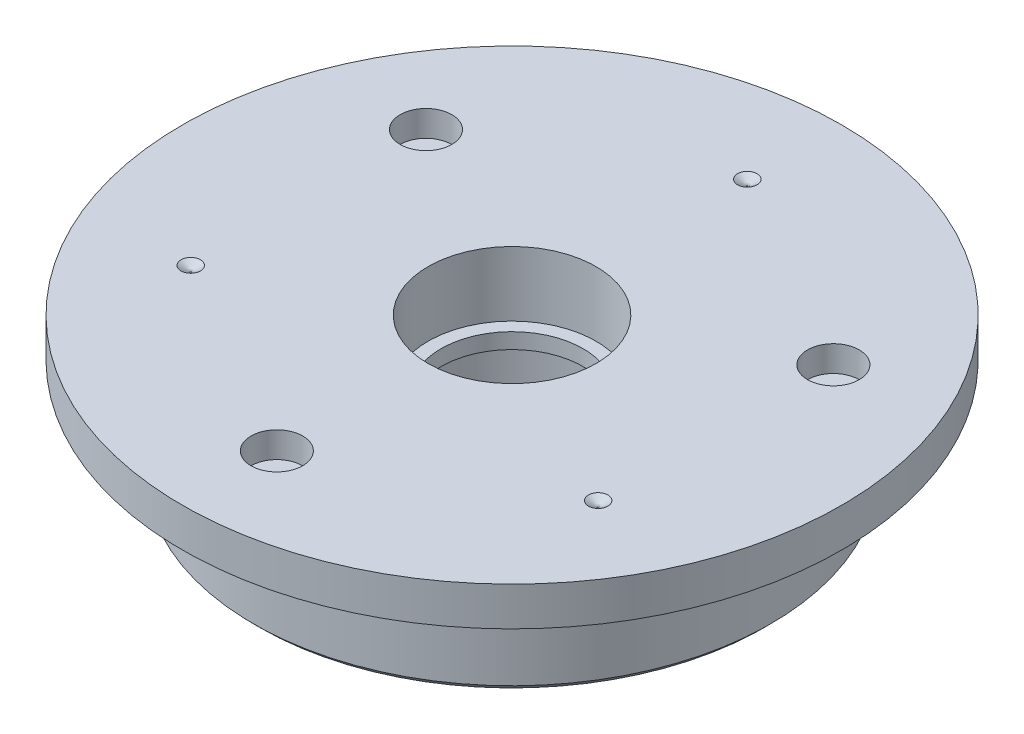
from build123d import *

# Parameters (mm, degrees)
SKETCH_1_W                  = 25.5
SKETCH_1_H                  = 3
SKETCH_2_R                  = 21.5
EXTRUDE_1_DEPTH             = 0.8
SKETCH_3_R                  = 20
EXTRUDE_2_DEPTH             = 7.4
HOLE_WIZARD_3_0_3_1_D       = 3
HOLE_WIZARD_3_0_3_1_DEPTH   = 3
HOLE_WIZARD_3_3_3_3_1_D     = 3.3
HOLE_WIZARD_3_3_3_3_1_DEPTH = 8
HOLE_WIZARD_3_3_3_3_1_TIP   = 0.991420021
HOLE_WIZARD_4_0_4_1_D       = 4
HOLE_WIZARD_4_0_4_1_DEPTH   = 2
CHAMFER_1_SIZE              = 0.375
CHAMFER_2_SIZE              = 0.5


with BuildPart() as part:
    # 草图1 → 旋转1 (revolve)
    with BuildSketch(Plane.XY):
        with Locations((12.75, -18.3)):
            Rectangle(SKETCH_1_W, SKETCH_1_H)
    revolve(axis=Axis((0, -16.8, 0), (0, -1, 0)))

    # 草图2 → 凸台-拉伸1 (add)
    with BuildSketch(Plane.XZ.offset(19.8)):
        Circle(SKETCH_2_R)
    extrude(amount=EXTRUDE_1_DEPTH)

    # 草图3 → 凸台-拉伸2 (add)
    with BuildSketch(Plane.XZ.offset(20.6)):
        Circle(SKETCH_3_R)
    extrude(amount=EXTRUDE_2_DEPTH)

    # 草图4 → 切除-旋转1 (revolve, cut)
    with BuildSketch(Plane.XY.offset(9.1)):
        Polygon((-15.010946194, -16.8), (-15.761662349, -16.8), (-15.761662349, -17.251075774), align=None)
    revolve(axis=Axis((-15.761662349, -16.8, 9.1), (0, -1, 0)), mode=Mode.SUBTRACT)

    # 草图5 → 切除-旋转2 (revolve, cut)
    with BuildSketch(Plane.XY.offset(9.1)):
        Polygon((16.512378504, -16.8), (15.761662349, -16.8), (15.761662349, -17.251075774), align=None)
    revolve(axis=Axis((15.761662349, -16.8, 9.1), (0, -1, 0)), mode=Mode.SUBTRACT)

    # 草图6 → 切除-旋转3 (revolve, cut)
    with BuildSketch(Plane.XY.offset(-18.2)):
        Polygon((0.750716155, -16.8), (0, -16.8), (0, -17.251075774), align=None)
    revolve(axis=Axis((0, -16.8, -18.2), (0, -1, 0)), mode=Mode.SUBTRACT)

    # 草图7 → 切除-旋转4 (revolve, cut)
    with BuildSketch(Plane(origin=(0, 0, 0), x_dir=(-1, 0, 0), z_dir=(0, 0, -1))):
        Polygon((-9, -28), (0, -28), (0, -16.8), (-6.5, -16.8), (-6.5, -21.8), (-5.5, -21.8), (-5.5, -23), (-9, -23), align=None)
    revolve(axis=Axis((0, -28, 0), (0, 1, 0)), mode=Mode.SUBTRACT)

    # Ø3.0 (3) 直径孔1
    with Locations(Plane(origin=(0, -28, 0), x_dir=(-1, 0, 0), z_dir=(0, -1, 0))):
        with Locations((6, 10.392304845), (-6, -10.392304845)):
            Hole(HOLE_WIZARD_3_0_3_1_D / 2, depth=HOLE_WIZARD_3_0_3_1_DEPTH)

    # Ø3.3 (3.3) 直径孔1
    with Locations(Plane(origin=(0, -28, 0), x_dir=(-1, 0, 0), z_dir=(0, -1, 0))):
        with Locations((10.392304845, -6), (0, -12), (-10.392304845, -6), (-10.392304845, 6), (0, 12), (10.392304845, 6)):
            Hole(HOLE_WIZARD_3_3_3_3_1_D / 2, depth=HOLE_WIZARD_3_3_3_3_1_DEPTH)
            with Locations((0, 0, -(HOLE_WIZARD_3_3_3_3_1_DEPTH + HOLE_WIZARD_3_3_3_3_1_TIP / 2))):  # 118° drill point
                Cone(0, HOLE_WIZARD_3_3_3_3_1_D / 2, HOLE_WIZARD_3_3_3_3_1_TIP, mode=Mode.SUBTRACT)

    # Ø4.0 (4) 直径孔1
    with Locations(Plane(origin=(0, -16.8, 0), x_dir=(1, 0, 0), z_dir=(0, 1, 0))):
        with Locations((15.761662349, 9.1), (0, -18.2), (-15.761662349, 9.1)):
            Hole(HOLE_WIZARD_4_0_4_1_D / 2, depth=HOLE_WIZARD_4_0_4_1_DEPTH)

    # 倒角1
    chamfer_1_edges = [part.edges().sort_by_distance(p)[0] for p in [
        (-1.65, -28, -12),
        (8.742304845, -28, -6),
        (-12.042304845, -28, 6),
        (-12.042304845, -28, -6),
        (-1.65, -28, 12),
        (8.742304845, -28, 6),
    ]]
    chamfer(chamfer_1_edges, length=CHAMFER_1_SIZE)

    # 倒角2
    chamfer_2_edges = [part.edges().sort_by_distance(p)[0] for p in [
        (-20, -28, 0),
    ]]
    chamfer(chamfer_2_edges, length=CHAMFER_2_SIZE)


solid = part.part
